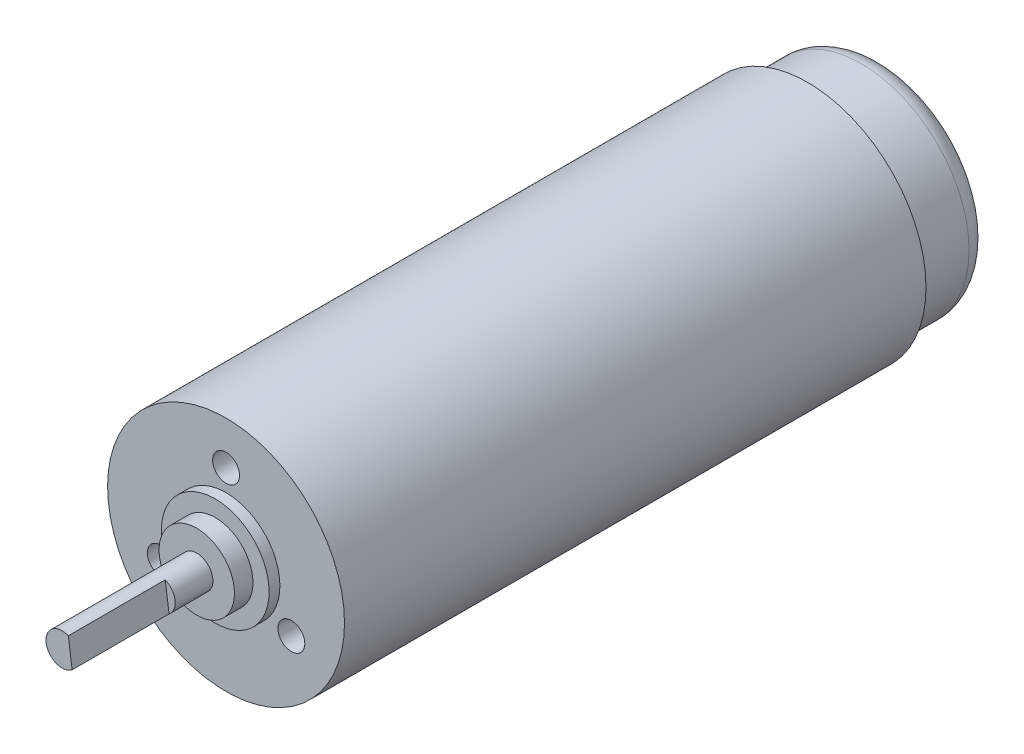
from build123d import *

# Parameters (mm, degrees)
SKETCH1_R               = 10
BOSS_EXTRUDE1_DEPTH     = 7
SKETCH2_R               = 11
BOSS_EXTRUDE2_DEPTH     = 54
SKETCH3_R               = 5
BOSS_EXTRUDE4_DEPTH     = 1
SKETCH5_R               = 3.5
BOSS_EXTRUDE5_DEPTH     = 1.72
SKETCH6_R               = 1.5
BOSS_EXTRUDE6_DEPTH     = 12.5
CUT_EXTRUDE1_DEPTH      = 78.79131314
CUT_EXTRUDE1_DEPTH_BACK = 9
SKETCH18_R              = 1.25
CUT_EXTRUDE2_DEPTH      = 9
CIRPATTERN1_COUNT       = 3
FILLET1_R               = 2


with BuildPart() as part:
    # Sketch1 → Boss-Extrude1 (new body)
    with BuildSketch(Plane.XY):
        Circle(SKETCH1_R)
    extrude(amount=BOSS_EXTRUDE1_DEPTH)

    # Sketch2 → Boss-Extrude2 (add)
    with BuildSketch(Plane.XY.offset(7)):
        Circle(SKETCH2_R)
    extrude(amount=BOSS_EXTRUDE2_DEPTH)

    # Sketch3 → Boss-Extrude4 (add)
    with BuildSketch(Plane.XY.offset(61)):
        Circle(SKETCH3_R)
    extrude(amount=BOSS_EXTRUDE4_DEPTH)

    # Sketch5 → Boss-Extrude5 (add)
    with BuildSketch(Plane.XY.offset(62)):
        Circle(SKETCH5_R)
    extrude(amount=BOSS_EXTRUDE5_DEPTH)

    # Sketch6 → Boss-Extrude6 (add)
    with BuildSketch(Plane.XY.offset(63.72)):
        Circle(SKETCH6_R)
    extrude(amount=BOSS_EXTRUDE6_DEPTH)

    # Sketch17 → Cut-Extrude1 (cut, two sides: drawn at the far end of the back side and taken through both)
    with BuildSketch(Plane.XY.offset(76.22).offset(-CUT_EXTRUDE1_DEPTH_BACK)):
        Polygon((-5.420596237, 45.068969585), (0.575645512, 1.385147012), (0.927585542, -1.178806626), (6.923827291, -44.862629199), (94.291472437, -32.870145701), (81.947048908, 57.061453083), align=None)
    extrude(amount=CUT_EXTRUDE1_DEPTH + CUT_EXTRUDE1_DEPTH_BACK, mode=Mode.SUBTRACT)

    # Sketch18 → Cut-Extrude2 (cut)
    with BuildSketch(Plane.XY.offset(61)):
        with Locations((0, 7)):
            Circle(SKETCH18_R)
    cut_extrude2 = extrude(amount=-CUT_EXTRUDE2_DEPTH, mode=Mode.SUBTRACT)

    # CirPattern1: Cut-Extrude2 ×3 about axis
    cirpattern1_axis = Axis((0, 0, 61), (0, 0, 1))
    for i in range(1, CIRPATTERN1_COUNT):
        add(cut_extrude2.rotate(cirpattern1_axis, i * 360 / CIRPATTERN1_COUNT), mode=Mode.SUBTRACT)

    # Fillet1
    fillet1_edges = [part.edges().sort_by_distance(p)[0] for p in [
        (-10, 0, 0),
    ]]
    fillet(fillet1_edges, radius=FILLET1_R)


solid = part.part
